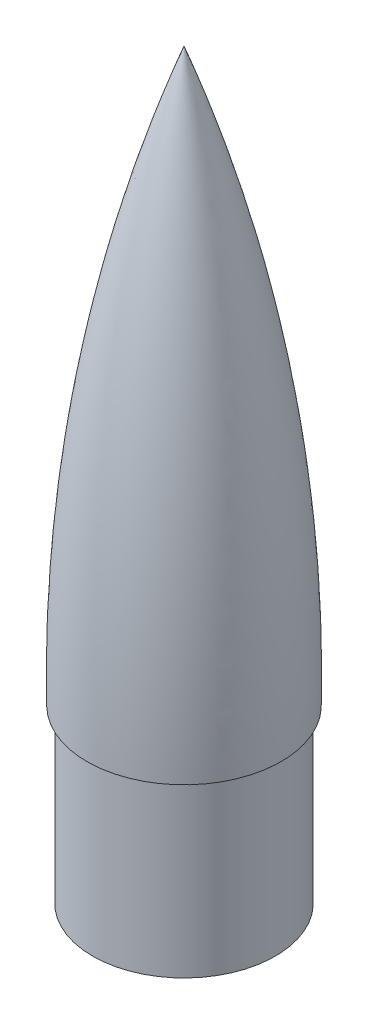
from build123d import *

# Parameters (mm, degrees)
SKETCH_1_R                = 16
SKETCH_1_R_2              = 15
EXTRUDE_1_DEPTH           = 30
REVOLVE_2_ANGLE           = 30
REVOLVE_2_OTHER_WAY_ANGLE = 30
REVOLVE_3_ANGLE           = 30
REVOLVE_3_OTHER_WAY_ANGLE = 30
REVOLVE_4_ANGLE           = 30
REVOLVE_4_OTHER_WAY_ANGLE = 30
SKETCH_17_R               = 0.5
CUT_EXTRUDE_4_DEPTH       = 10


with BuildPart() as part:
    # Эскиз1 → Бобышка-Вытянуть1 (new body)
    with BuildSketch(Plane(origin=(0, 0, 0), x_dir=(1, 0, 0), z_dir=(0, 1, 0))):
        Circle(SKETCH_1_R)
        Circle(SKETCH_1_R_2, mode=Mode.SUBTRACT)
    extrude(amount=EXTRUDE_1_DEPTH)

    # Эскиз5 → Повернуть1 (revolve)
    with BuildSketch(Plane.XY):
        with BuildLine():
            Line((0, 30), (0, 130))
            ThreePointArc((0, 130), (-13.157936889, 80.791849271), (-17, 30))
            Line((-17, 30), (0, 30))
        make_face()
    revolve(axis=Axis((0, 100, 0), (0, -1, 0)))

    # Эскиз6 → Вырез-Повернуть1 (revolve, cut)
    with BuildSketch(Plane.XY):
        with BuildLine():
            Line((0, 128), (0, 30))
            Line((0, 30), (-15, 30))
            add(Edge.make_bspline(
                [(-15.031157371, 37.151771201), (-15.148384679, 32.18017582), (-15, 30)],
                knots=[0, 0, 0, 1, 1, 1], degree=2))
            ThreePointArc((-15.031157371, 37.151771201), (-12.64765752, 70.820234872), (-6.121243901, 103.935977998))
            add(Edge.make_bspline(
                [(0, 128), (-1.285260326, 123.677634701), (-2.143778885, 120.771879578), (-6.121243901, 103.935977998)],
                knots=[0, 0, 0, 0, 1, 1, 1, 1], degree=3))
        make_face()
    revolve(axis=Axis((0, 128, 0), (0, -1, 0)), mode=Mode.SUBTRACT)

    # Эскиз7 → Повернуть2 (revolve)
    with BuildSketch(Plane.XY):
        with BuildLine():
            Line((9.091157371, 37.151771201), (15.031157371, 37.151771201))
            ThreePointArc((15.031157371, 37.151771201), (14.965824098, 41.153903713), (14.769893903, 45.151771201))
            Line((14.769893903, 45.151771201), (9.091157371, 45.151771201))
            Line((9.091157371, 45.151771201), (9.091157371, 37.151771201))
        make_face()
    revolve(axis=Axis((0, 133.41555668, 0), (0, -1, 0)), revolution_arc=REVOLVE_2_ANGLE)

    # Эскиз7 → Повернуть2 other way (revolve)
    with BuildSketch(Plane.XY):
        with BuildLine():
            Line((9.091157371, 37.151771201), (15.031157371, 37.151771201))
            ThreePointArc((15.031157371, 37.151771201), (14.965824098, 41.153903713), (14.769893903, 45.151771201))
            Line((14.769893903, 45.151771201), (9.091157371, 45.151771201))
            Line((9.091157371, 45.151771201), (9.091157371, 37.151771201))
        make_face()
    revolve(axis=Axis((0, 133.41555668, 0), (0, 1, 0)), revolution_arc=REVOLVE_2_OTHER_WAY_ANGLE)

    # Эскиз11 → Повернуть3 (revolve)
    with BuildSketch(Plane.XY):
        with BuildLine():
            Line((-14.769893903, 45.151771201), (-9.091157371, 45.151771201))
            Line((-9.091157371, 45.151771201), (-9.091157371, 37.151771201))
            Line((-9.091157371, 37.151771201), (-15.031157371, 37.151771201))
            ThreePointArc((-15.031157371, 37.151771201), (-14.965824098, 41.153903713), (-14.769893903, 45.151771201))
        make_face()
    revolve(axis=Axis((0, -11.339924924, 0), (0, 1, 0)), revolution_arc=REVOLVE_3_ANGLE)

    # Эскиз11 → Повернуть3 other way (revolve)
    with BuildSketch(Plane.XY):
        with BuildLine():
            Line((-14.769893903, 45.151771201), (-9.091157371, 45.151771201))
            Line((-9.091157371, 45.151771201), (-9.091157371, 37.151771201))
            Line((-9.091157371, 37.151771201), (-15.031157371, 37.151771201))
            ThreePointArc((-15.031157371, 37.151771201), (-14.965824098, 41.153903713), (-14.769893903, 45.151771201))
        make_face()
    revolve(axis=Axis((0, -11.339924924, 0), (0, -1, 0)), revolution_arc=REVOLVE_3_OTHER_WAY_ANGLE)

    # Эскиз14 → Повернуть4 (revolve)
    with BuildSketch(Plane.XY):
        Polygon((-15.057402506, 35.151771201), (-15.031157371, 37.151771201), (-9.091157371, 37.151771201), (-9.091157371, 35.151771201), align=None)
        Polygon((9.091157371, 37.151771201), (9.091157371, 35.151771201), (15.057402506, 35.151771201), (15.031157371, 37.151771201), align=None)
    revolve(axis=Axis((0, -7.826271644, 0), (0, 1, 0)), revolution_arc=REVOLVE_4_ANGLE)

    # Эскиз14 → Повернуть4 other way (revolve)
    with BuildSketch(Plane.XY):
        Polygon((-15.057402506, 35.151771201), (-15.031157371, 37.151771201), (-9.091157371, 37.151771201), (-9.091157371, 35.151771201), align=None)
        Polygon((9.091157371, 37.151771201), (9.091157371, 35.151771201), (15.057402506, 35.151771201), (15.031157371, 37.151771201), align=None)
    revolve(axis=Axis((0, -7.826271644, 0), (0, -1, 0)), revolution_arc=REVOLVE_4_OTHER_WAY_ANGLE)

    # Эскиз17 → Вырез-Вытянуть4 (cut)
    with BuildSketch(Plane.XZ.offset(-35.151771201)):
        with Locations((11.72, 0)):
            Circle(SKETCH_17_R)
        with Locations((-11.72, 0)):
            Circle(SKETCH_17_R)
    extrude(amount=-CUT_EXTRUDE_4_DEPTH, mode=Mode.SUBTRACT)


solid = part.part
